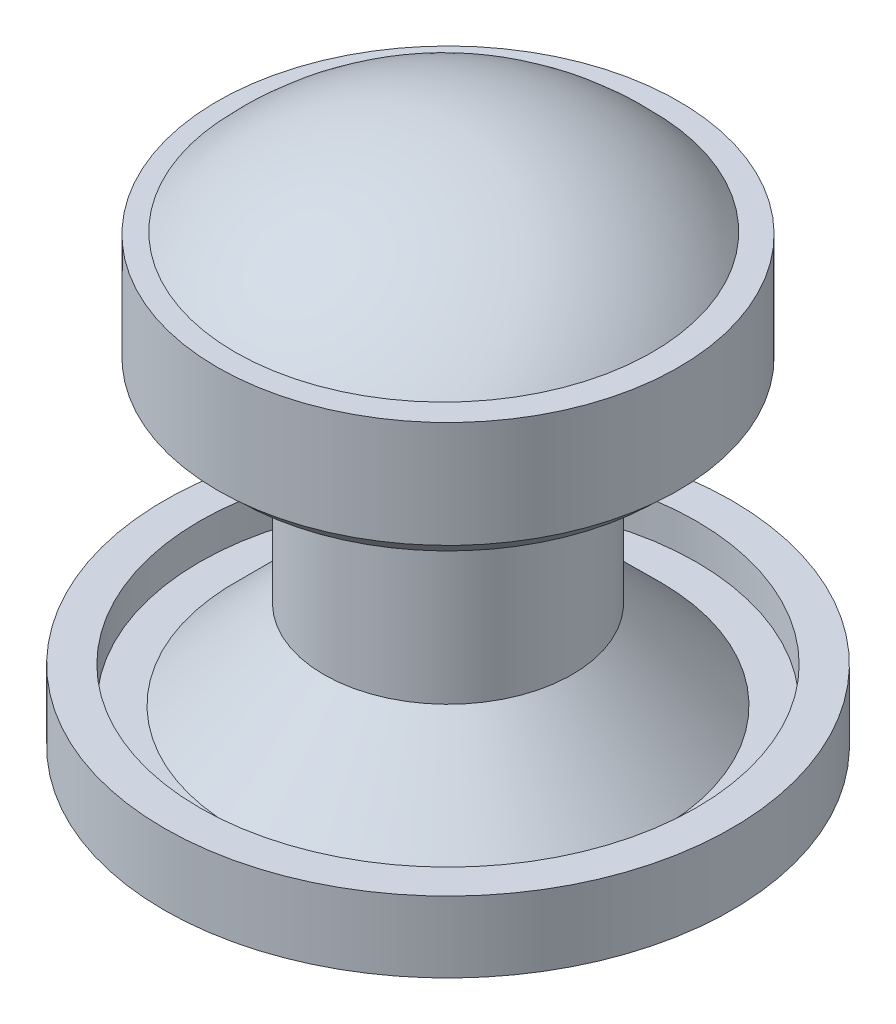
from build123d import *
from build123d.topology import SkipClean

# Parameters (mm, degrees)
SKETCH1_R           = 8
BOSS_EXTRUDE1_DEPTH = 1
SKETCH2_R           = 6
BOSS_EXTRUDE2_DEPTH = 2.5
BOSS_EXTRUDE2_TAPER = 45
SKETCH3_R           = 3.5
BOSS_EXTRUDE3_DEPTH = 4
SKETCH4_R           = 3.5
BOSS_EXTRUDE4_DEPTH = 1
BOSS_EXTRUDE4_DRAFT = -59
SKETCH6_R           = 5.164279482
BOSS_EXTRUDE5_DEPTH = 1
SKETCH7_R           = 6.5
BOSS_EXTRUDE6_DEPTH = 3
SKETCH9_R           = 8
SKETCH9_R_2         = 7
BOSS_EXTRUDE7_DEPTH = 1
SKETCH10_R          = 1.4
CUT_EXTRUDE1_DEPTH  = 6


with BuildPart() as part:
    # Sketch1 → Boss-Extrude1 (new body)
    with BuildSketch(Plane(origin=(0, 0, 0), x_dir=(1, 0, 0), z_dir=(0, 1, 0))):
        with Locations(Location((0, 0, 0), (0, 0, 270))):
            Circle(SKETCH1_R)
    extrude(amount=BOSS_EXTRUDE1_DEPTH)

    # Sketch2 → Boss-Extrude2 (add)
    with BuildSketch(Plane(origin=(0, 1, 0), x_dir=(1, 0, 0), z_dir=(0, 1, 0))):
        Circle(SKETCH2_R)
    extrude(amount=BOSS_EXTRUDE2_DEPTH, taper=BOSS_EXTRUDE2_TAPER)

    # Sketch3 → Boss-Extrude3 (add)
    with BuildSketch(Plane(origin=(0, 3.5, 0), x_dir=(1, 0, 0), z_dir=(0, 1, 0))):
        with Locations(Location((0, 0, 0), (0, 0, 270))):
            Circle(SKETCH3_R)
    extrude(amount=BOSS_EXTRUDE3_DEPTH)


with BuildPart() as boss_extrude4_tool:
    # Sketch4 → Boss-Extrude4 (with draft: the straight prism first)
    with BuildSketch(Plane(origin=(0, 7.5, 0), x_dir=(1, 0, 0), z_dir=(0, 1, 0))):
        with Locations(Location((0, 0, 0), (0, 0, 270))):
            Circle(SKETCH4_R)
    extrude(amount=BOSS_EXTRUDE4_DEPTH)
    # Boss-Extrude4: the draft: its side faces are tilted about the plane it starts from
    boss_extrude4_sides = [boss_extrude4_tool.faces().sort_by_distance(p)[0] for p in [
        (0, 8, -3.5),
    ]]
    draft(boss_extrude4_sides, Plane(origin=(0, 7.5, 0), x_dir=(1, 0, 0), z_dir=(0, 1, 0)), BOSS_EXTRUDE4_DRAFT)


with BuildPart() as part_1:
    add(part.part)

    # Boss-Extrude4: add boss_extrude4_tool
    add(boss_extrude4_tool.part)

    # Sketch6 → Boss-Extrude5 (add)
    with BuildSketch(Plane(origin=(0, 8.5, 0), x_dir=(1, 0, 0), z_dir=(0, 1, 0))):
        with Locations(Location((0, 0, 0), (0, 0, 270))):
            Circle(SKETCH6_R)
    extrude(amount=BOSS_EXTRUDE5_DEPTH)

    # Sketch7 → Boss-Extrude6 (add)
    with BuildSketch(Plane(origin=(0, 9.5, 0), x_dir=(1, 0, 0), z_dir=(0, 1, 0))):
        with Locations(Location((0, 0, 0), (0, 0, 270))):
            Circle(SKETCH7_R)
    extrude(amount=BOSS_EXTRUDE6_DEPTH)

    # Sketch8 → Revolve1 (revolve)
    with SkipClean():  # the faces are left unmerged after this step: merging them gives an invalid solid
        with BuildSketch(Plane.XY):
            with BuildLine():
                ThreePointArc((-0.12, 15.075463153), (-3.329649921, 14.403365131), (-6, 12.5))
                Line((-6, 12.5), (-0.12, 12.5))
                Line((-0.12, 12.5), (-0.12, 15.075463153))
            make_face()
            with BuildLine():
                Line((-0.12, 15.075463153), (-0.12, 12.5))
                Line((-0.12, 12.5), (5.76, 12.5))
                ThreePointArc((5.76, 12.5), (3.089649921, 14.403365131), (-0.12, 15.075463153))
            make_face()
        revolve(axis=Axis((-0.12, 12.5, 0), (0, 1, 0)))
    add(part_1.part.scale(1), mode=Mode.REPLACE)  # the faces are merged on a copy

    # Sketch9 → Boss-Extrude7 (add)
    with BuildSketch(Plane(origin=(0, 1, 0), x_dir=(1, 0, 0), z_dir=(0, 1, 0))):
        with Locations(Location((0, 0, 0), (0, 0, 270))):
            Circle(SKETCH9_R)
        with Locations(Location((0, 0, 0), (0, 0, 270))):
            Circle(SKETCH9_R_2, mode=Mode.SUBTRACT)
    extrude(amount=BOSS_EXTRUDE7_DEPTH)

    # Sketch10 → Cut-Extrude1 (cut)
    with BuildSketch(Plane.XZ):
        with Locations(Location((0, 0, 0), (0, 0, 270))):
            Circle(SKETCH10_R)
    extrude(amount=-CUT_EXTRUDE1_DEPTH, mode=Mode.SUBTRACT)

    # Chamfer1: read off the stored shape, not the designer's step
    # Chamfer1 outline → Chamfer1 (revolve)
    with BuildSketch(Plane.XY):
        Polygon((5.164279482, 9.5), (5.164279482, 8.5), (5.915896622, 8.95161714), (6.464279482, 9.5), align=None)
    revolve(axis=Axis((0, 0, 0), (0, 1, 0)))


solid = part_1.part
